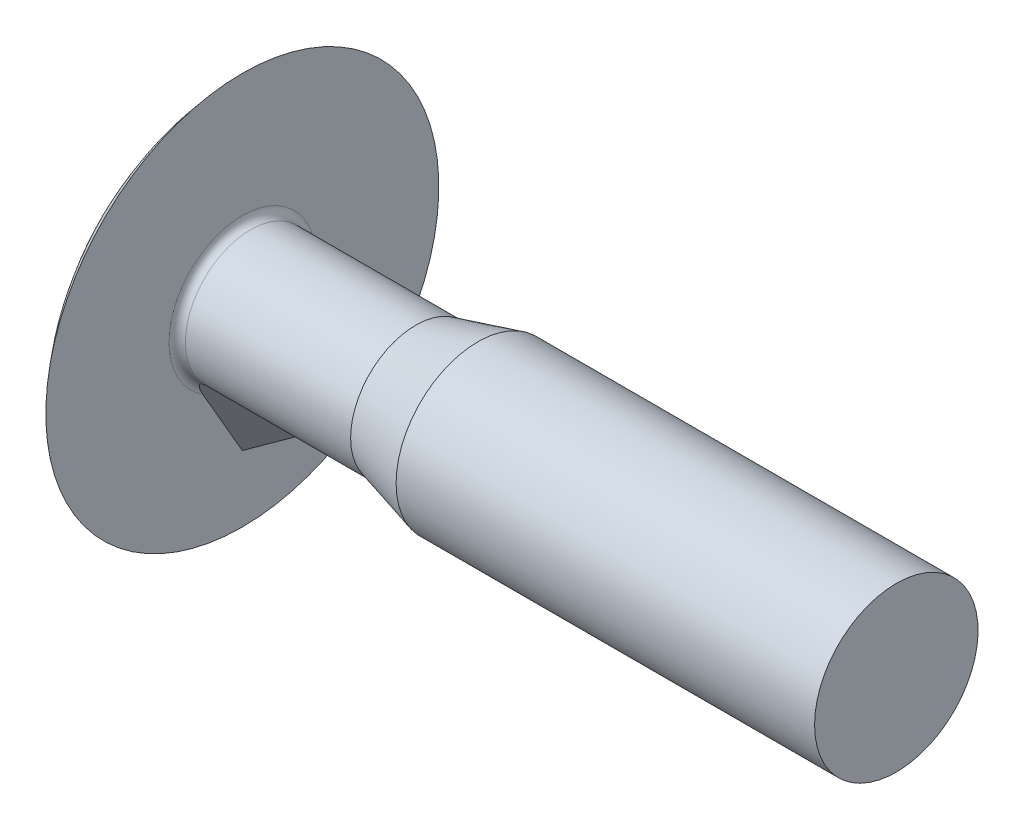
from build123d import *

# Parameters (mm, degrees)
SKETCH2_R      = 5
BASEBODY_DEPTH = 40
FILLET1_R      = 0.5


with BuildPart() as part:
    # Sketch1 → BaseHead (revolve)
    with BuildSketch(Plane(origin=(-7.690583732, 4.327735618, 0), x_dir=(0, 1, 0), z_dir=(0, 0, 1))):
        with BuildLine():
            Line((-4.327735618, -12.290583732), (-16.346054968, -12.290583732))
            ThreePointArc((-16.346054968, -12.290583732), (-10.762018795, -8.879872861), (-4.327735618, -7.690583732))
            Line((-4.327735618, -7.690583732), (-4.327735618, -12.290583732))
        make_face()
    revolve(axis=Axis((-9.007048787, 0, 0), (1, 0, 0)))

    # Sketch2 → BaseBody (add)
    with BuildSketch(Plane(origin=(4.6, 0, 0), x_dir=(0, 0, -1), z_dir=(1, 0, 0))):
        Circle(SKETCH2_R)
    extrude(amount=BASEBODY_DEPTH)

    # Sketch3 → Cut-Revolve1 (revolve, cut)
    with BuildSketch(Plane(origin=(-15.854395091, 0, 20.854395091), x_dir=(0, 0, -1), z_dir=(0, 1, 0))):
        Polygon((25.854395091, -34.860395091), (24.83618816, -31.060395091), (24.83618816, -20.454395091), (25.854395091, -20.454395091), align=None)
    revolve(axis=Axis((-22.018002757, 0, 0), (1, 0, 0)), mode=Mode.SUBTRACT)

    # Fillet1
    fillet1_edges = [part.edges().sort_by_distance(p)[0] for p in [
        (4.6, 0, 3.981793069),
    ]]
    fillet(fillet1_edges, radius=FILLET1_R)

    # Sketch4 → Nib section 0
    with BuildSketch(Plane(origin=(4.6, 10.71872448, 8.842645962), x_dir=(0, 0, 1), z_dir=(1, 0, 0)), mode=Mode.PRIVATE) as nib_s0:
        with BuildLine():
            Line((-12.290979912, 12.709621015), (-8.842645962, 18.682310618))
            Line((-8.842645962, 18.682310618), (-5.394312012, 12.709621015))
            Line((-5.394312012, 12.709621015), (-12.290979912, 12.709621015))
        make_face()
    loft([nib_s0.sketch, Vertex(10.1, -3.981793069, 0)])


solid = part.part
